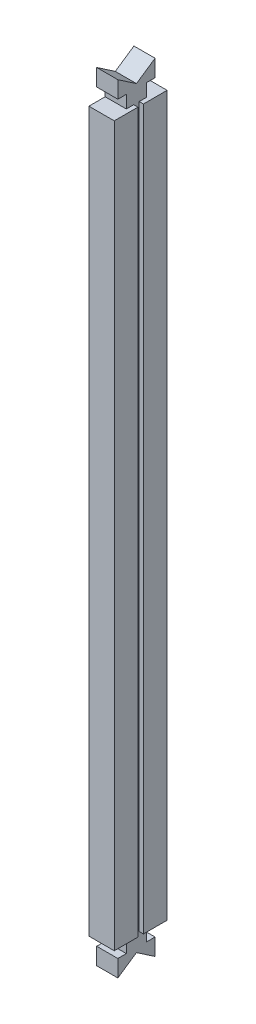
from build123d import *

# Parameters (mm, degrees)
BOSS_EXTRUDE1_DEPTH = 6.35
SKETCH2_W           = 7.112
SKETCH2_H           = 215.9
BOSS_EXTRUDE2_DEPTH = 1.27


with BuildPart() as part:
    # Sketch1 → Boss-Extrude1 (new body)
    with BuildSketch(Plane(origin=(0, 0, 0), x_dir=(0, 0, -1), z_dir=(1, 0, 0))):
        Polygon((-7.9375, 9.525), (-3.048, 9.525), (-3.048, 5.715), (-5.588, 5.715), (-5.588, 0.635), (0, 4.445), (5.588, 0.635), (5.588, 5.715), (3.048, 5.715), (3.048, 9.525), (7.9375, 9.525), (7.9375, 225.425), (3.048, 225.425), (3.048, 229.235), (5.588, 229.235), (5.588, 234.315), (0, 230.505), (-5.588, 234.315), (-5.588, 229.235), (-3.048, 229.235), (-3.048, 225.425), (-7.9375, 225.425), align=None)
    extrude(amount=BOSS_EXTRUDE1_DEPTH)

    # Sketch2 → Boss-Extrude2 (add)
    with BuildSketch(Plane(origin=(6.35, 0, 0), x_dir=(0, 0, -1), z_dir=(1, 0, 0))):
        with Locations((4.3815, 117.475)):
            Rectangle(SKETCH2_W, SKETCH2_H)
        with Locations((-4.3815, 117.475)):
            Rectangle(SKETCH2_W, SKETCH2_H)
    extrude(amount=BOSS_EXTRUDE2_DEPTH)


solid = part.part
